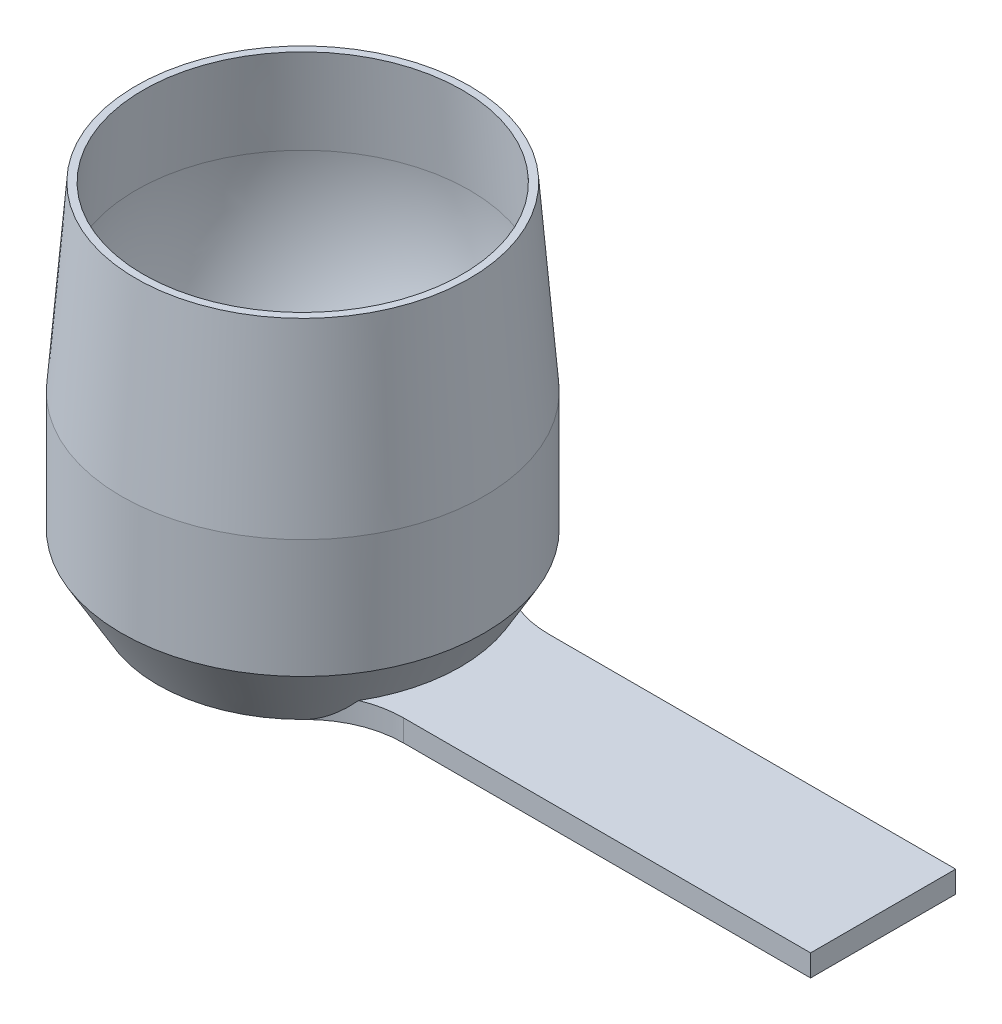
from build123d import *

# Parameters (mm, degrees)
BOSS_EXTRUDE2_DEPTH = 3


with BuildPart() as part:
    # Sketch6 → Revolve1 (revolve)
    with BuildSketch(Plane(origin=(0, 0, 0), x_dir=(0, 0, -1), z_dir=(1, 0, 0))):
        with BuildLine():
            Line((0, 0), (-20, 0))
            Line((-20, 0), (-25, 8.660254038))
            Line((-25, 8.660254038), (-25, 25))
            Line((-25, 25), (-23, 50))
            Line((-23, 50), (-22, 50))
            Line((-22, 50), (-22.995912017, 37.551099788))
            add(Edge.make_bspline(
                [(-22.995912017, 37.551099788), (-24.256638157, 21.792023041), (-15.392731356, 8.115835775), (-2, 0.8)],
                knots=[0, 0, 0, 0, 1, 1, 1, 1], degree=3))
            Line((-2, 0.8), (0, 0.8))
            Line((0, 0.8), (0, 0))
        make_face()
    revolve(axis=Axis((0, 0.628504357, 0), (0, 1, 0)))

    # Sketch7 → Boss-Extrude2 (add)
    with BuildSketch(Plane(origin=(0, 0, 0), x_dir=(1, 0, 0), z_dir=(0, 1, 0))):
        with BuildLine():
            Line((23.887428117, -10), (80, -10))
            Line((80, -10), (80, 10))
            Line((80, 10), (23.887428117, 10))
            ThreePointArc((23.887428117, 10), (18.662529879, 11.049522995), (14.248195421, 14.035274392))
            ThreePointArc((14.248195421, 14.035274392), (20, 0), (14.248195421, -14.035274392))
            ThreePointArc((14.248195421, -14.035274392), (18.662529879, -11.049522995), (23.887428117, -10))
        make_face()
    extrude(amount=BOSS_EXTRUDE2_DEPTH)


solid = part.part
